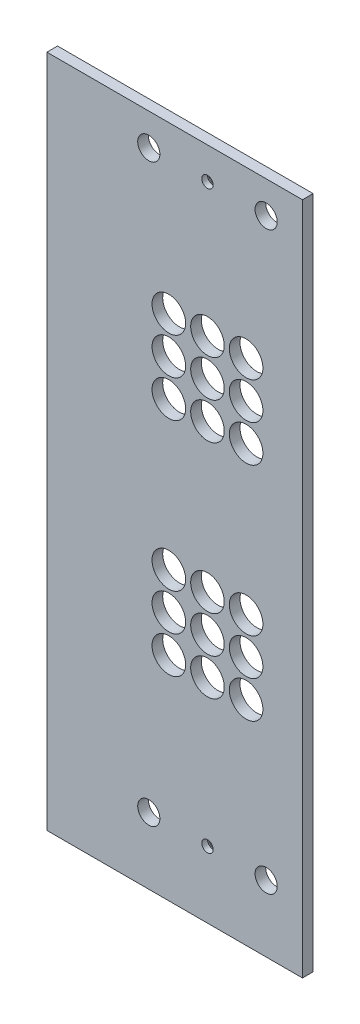
from build123d import *

# Parameters (mm, degrees)
SKETCH1_W                                       = 56.55
SKETCH1_H                                       = 197.425
BOSS_EXTRUDE1_DEPTH                             = 3.175
SKETCH2_R                                       = 5
CUT_EXTRUDE1_DEPTH                              = 103.731270343
SKETCH5_W                                       = 3.175
SKETCH5_H                                       = 197.425
BOSS_EXTRUDE2_DEPTH                             = 19.525
SKETCH14_W                                      = 76.075
SKETCH14_H                                      = 3.175
BOSS_EXTRUDE3_DEPTH                             = 3.175
M6_CLEARANCE_HOLE1_D                            = 6.6
CSK_FOR_M3_FLAT_HEAD_MACHINE_SCREW3_D           = 3.4
CSK_FOR_M3_FLAT_HEAD_MACHINE_SCREW3_CSINK_D     = 6.3
CSK_FOR_M3_FLAT_HEAD_MACHINE_SCREW3_CSINK_ANGLE = 90


with BuildPart() as part:
    # Sketch1 → Boss-Extrude1 (new body)
    with BuildSketch(Plane.XY):
        Rectangle(SKETCH1_W, SKETCH1_H)
    extrude(amount=BOSS_EXTRUDE1_DEPTH)

    # Sketch2 → Cut-Extrude1 (cut, through all)
    with BuildSketch(Plane(origin=(0, 0, 0), x_dir=(-1, 0, 0), z_dir=(0, 0, -1))):
        with Locations((-11.5, 30.630837161)):
            Circle(SKETCH2_R)
        with Locations((-11.5, 52.630837161)):
            Circle(SKETCH2_R)
        with Locations((-11.5, 41.630837161)):
            Circle(SKETCH2_R)
        with Locations((0, 52.630837161)):
            Circle(SKETCH2_R)
        with Locations((0, 41.630837161)):
            Circle(SKETCH2_R)
        with Locations((0, 30.630837161)):
            Circle(SKETCH2_R)
        with Locations((11.5, 30.630837161)):
            Circle(SKETCH2_R)
        with Locations((11.5, 41.630837161)):
            Circle(SKETCH2_R)
        with Locations((11.5, 52.630837161)):
            Circle(SKETCH2_R)
        with Locations((-11.5, -35.369162839)):
            Circle(SKETCH2_R)
        with Locations((-11.5, -13.369162839)):
            Circle(SKETCH2_R)
        with Locations((-11.5, -24.369162839)):
            Circle(SKETCH2_R)
        with Locations((0, -13.369162839)):
            Circle(SKETCH2_R)
        with Locations((0, -24.369162839)):
            Circle(SKETCH2_R)
        with Locations((0, -35.369162839)):
            Circle(SKETCH2_R)
        with Locations((11.5, -35.369162839)):
            Circle(SKETCH2_R)
        with Locations((11.5, -13.369162839)):
            Circle(SKETCH2_R)
        with Locations((11.5, -24.369162839)):
            Circle(SKETCH2_R)
    extrude(amount=-CUT_EXTRUDE1_DEPTH, mode=Mode.SUBTRACT)

    # Sketch5 → Boss-Extrude2 (add)
    with BuildSketch(Plane.ZY.offset(28.275)):
        with Locations((1.5875, 0)):
            Rectangle(SKETCH5_W, SKETCH5_H)
    extrude(amount=BOSS_EXTRUDE2_DEPTH)

    # Sketch14 → Boss-Extrude3 (add)
    with BuildSketch(Plane(origin=(0, 98.7125, 0), x_dir=(1, 0, 0), z_dir=(0, 1, 0))):
        with Locations((-9.7625, -1.5875)):
            Rectangle(SKETCH14_W, SKETCH14_H)
    extrude(amount=BOSS_EXTRUDE3_DEPTH)

    # M6 Clearance Hole1 (through all)
    with Locations(Plane.XY.offset(3.175)):
        with Locations((-17.4625, 92.3625001), (17.4625, 92.3625001), (17.4625, -78.8874999), (-17.4625, -78.8874999)):
            Hole(M6_CLEARANCE_HOLE1_D / 2)

    # CSK for M3 Flat Head Machine Screw3 (through all)
    with Locations(Plane(origin=(0, 0, 0), x_dir=(-1, 0, 0), z_dir=(0, 0, -1))):
        with Locations((0, 92.3625001), (0, -78.8874999)):
            CounterSinkHole(CSK_FOR_M3_FLAT_HEAD_MACHINE_SCREW3_D / 2, CSK_FOR_M3_FLAT_HEAD_MACHINE_SCREW3_CSINK_D / 2, counter_sink_angle=CSK_FOR_M3_FLAT_HEAD_MACHINE_SCREW3_CSINK_ANGLE)


solid = part.part
